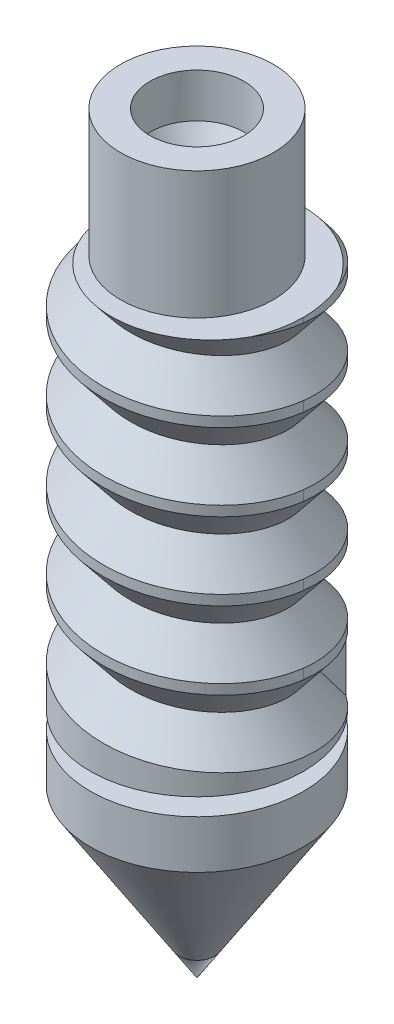
from build123d import *

# Parameters (mm, degrees)
CUT_SWEEP9_PITCH = 1.953846154


with BuildPart() as part:
    # Sketch1 → Revolve1 (revolve)
    with BuildSketch(Plane.XY):
        Polygon((0, 0), (2.697104334, 4.218980763), (2.697104334, 5.438459147), (1.935104334, 5.438459147), (1.935104334, 5.875667474), (2.697104334, 5.875667474), (2.697104334, 15.825259324), (1.935104334, 15.825259324), (1.935104334, 19.05), (1.190625, 19.05), (1.190625, 17.937222993), (0, 15.875), align=None)
    revolve(axis=Axis((0, 0, 0), (0, 1, 0)))

    # Cut-Sweep9: arcs per turn and ends read off the stored shape
    # Cut-Sweep9: the profile of Sketch4 profile screwed along a left-hand helix through 5.4 turns, 10 arcs to a turn; built about Z, then put on its axis
    cut_sweep9_z = Axis((0, 0, 0), (0, 0, 1))
    cut_sweep9_corners = [(2.012993376, -5.973e-06, -1.465383693), (2.697404334, -8.003e-06, -0.615087903), (2.697404334, -8.003e-06, -2.315679482)]
    with BuildLine(mode=Mode.PRIVATE) as cut_sweep9_profile:
        Line(cut_sweep9_corners[0], cut_sweep9_corners[1])
        Line(cut_sweep9_corners[1], cut_sweep9_corners[2])
        Line(cut_sweep9_corners[2], cut_sweep9_corners[0])
    cut_sweep9_cap = Face(cut_sweep9_profile.wire())
    cut_sweep9_turn_angles = [0, -18, -36, -54, -72, -90, -108, -126, -144, -162, -180, -198, -216, -234, -252, -270, -288, -306, -324, -342, -360]
    cut_sweep9_turn_weights = [1, 0.9510565162951535, 1, 0.9510565162951535, 1, 0.9510565162951535, 1, 0.9510565162951535, 1, 0.9510565162951535, 1, 0.9510565162951535, 1, 0.9510565162951535, 1, 0.9510565162951535, 1, 0.9510565162951535, 1, 0.9510565162951535, 1]
    cut_sweep9_turn_rails = [Edge.make_bspline([Vector(p[0], p[1], 0).rotate(cut_sweep9_z, cut_sweep9_turn_angles[k]) / cut_sweep9_turn_weights[k] + Vector(0, 0, p[2] + -CUT_SWEEP9_PITCH * cut_sweep9_turn_angles[k] / 360) for k in range(21)], [0, 0, 0, 1, 1, 2, 2, 3, 3, 4, 4, 5, 5, 6, 6, 7, 7, 8, 8, 9, 9, 10, 10, 10], 2, cut_sweep9_turn_weights) for p in cut_sweep9_corners]
    cut_sweep9_turn_sides = [Face.make_surface_from_curves(cut_sweep9_turn_rails[p[0]], cut_sweep9_turn_rails[p[1]]) for p in [(0, 1), (1, 2), (2, 0)]]
    cut_sweep9_last_angles = [-1800, -1818, -1836, -1854, -1872, -1890, -1908, -1926, -1944]
    cut_sweep9_last_weights = [1, 0.9510565162951535, 1, 0.9510565162951535, 1, 0.9510565162951535, 1, 0.9510565162951382, 1]
    cut_sweep9_last_rails = [Edge.make_bspline([Vector(p[0], p[1], 0).rotate(cut_sweep9_z, cut_sweep9_last_angles[k]) / cut_sweep9_last_weights[k] + Vector(0, 0, p[2] + -CUT_SWEEP9_PITCH * cut_sweep9_last_angles[k] / 360) for k in range(9)], [0, 0, 0, 1, 1, 2, 2, 3, 3, 4, 4, 4], 2, cut_sweep9_last_weights) for p in cut_sweep9_corners]
    cut_sweep9_last_sides = [Face.make_surface_from_curves(cut_sweep9_last_rails[p[0]], cut_sweep9_last_rails[p[1]]) for p in [(0, 1), (1, 2), (2, 0)]]
    cut_sweep9 = Plane(origin=(0, 15.825259324, 0), x_dir=(0, 0, 1), z_dir=(0, -1, 0)) * Solid(Shell([*[p.moved(Location((0, 0, CUT_SWEEP9_PITCH * i))) for i in range(5) for p in cut_sweep9_turn_sides], *cut_sweep9_last_sides, cut_sweep9_cap, cut_sweep9_cap.rotate(cut_sweep9_z, -1944).moved(Location((0, 0, -CUT_SWEEP9_PITCH * -1944 / 360)))]))
    add(cut_sweep9, mode=Mode.SUBTRACT)


solid = part.part
